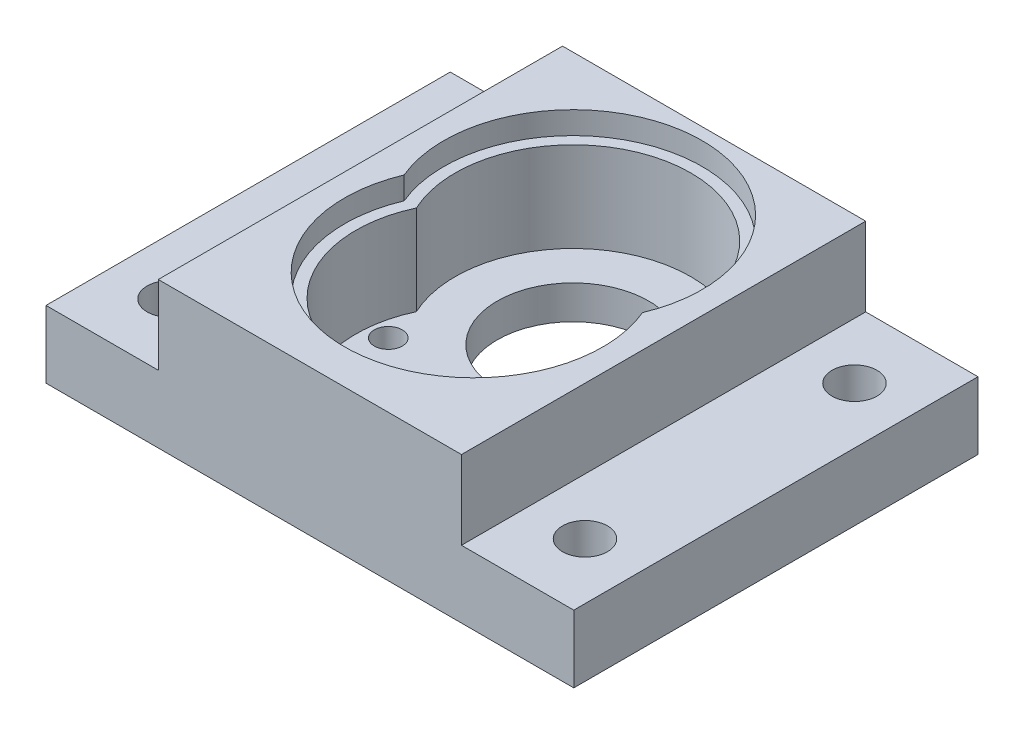
from build123d import *

# Parameters (mm, degrees)
SKETCH_1_W          = 27
SKETCH_1_H          = 36
SKETCH_1_R          = 6.75
SKETCH_1_R_2        = 1.5
SKETCH_1_R_3        = 1.25
EXTRUDE_1_DEPTH     = 3
SKETCH_4_W          = 10
SKETCH_4_H          = 6
EXTRUDE_3_DEPTH     = 36
SKETCH_6_R          = 3
CUT_EXTRUDE_3_DEPTH = 1
EXTRUDE_4_OUTLINE_W = 27
EXTRUDE_4_OUTLINE_H = 36
EXTRUDE_4_DEPTH     = 10
CUT_EXTRUDE_START   = 10
CUT_EXTRUDE_5_DEPTH = 2
SKETCH_13_R         = 2
CUT_EXTRUDE_6_DEPTH = 10


# Read off the part's stored shape, not the designer's step: 凸台-拉伸4
with BuildPart() as part:
    # 草图1 → 凸台-拉伸1 (new body)
    with BuildSketch(Plane(origin=(0, 0, 0), x_dir=(1, 0, 0), z_dir=(0, 1, 0))):
        with Locations((0, 2.267700118)):
            Rectangle(SKETCH_1_W, SKETCH_1_H)
        with Locations(Location((0, 7.7, 0), (0, 0, 270))):
            Circle(SKETCH_1_R, mode=Mode.SUBTRACT)
        with Locations(Location((0, -4.3, 0), (0, 0, 270))):
            Circle(SKETCH_1_R_2, mode=Mode.SUBTRACT)
        with Locations(Location((-8.75, 0, 0), (0, 0, 90))):
            Circle(SKETCH_1_R_3, mode=Mode.SUBTRACT)
        with Locations(Location((-2.7, -10.732299882, 0), (0, 0, 90))):
            Circle(SKETCH_1_R_2, mode=Mode.SUBTRACT)
        with Locations(Location((8.75, 0, 0), (0, 0, 270))):
            Circle(SKETCH_1_R_3, mode=Mode.SUBTRACT)
        with Locations(Location((2.7, -10.732299882, 0), (0, 0, 270))):
            Circle(SKETCH_1_R_2, mode=Mode.SUBTRACT)
    extrude(amount=EXTRUDE_1_DEPTH)

    # 草图4 → 凸台-拉伸3 (add)
    with BuildSketch(Plane(origin=(0, 0, -20.267700118), x_dir=(-1, 0, 0), z_dir=(0, 0, -1))):
        with Locations((-18.5, 3)):
            Rectangle(SKETCH_4_W, SKETCH_4_H)
        with Locations((18.5, 3)):
            Rectangle(SKETCH_4_W, SKETCH_4_H)
    extrude(amount=-EXTRUDE_3_DEPTH)

    # 草图6 → 切除-拉伸3 (cut)
    with BuildSketch(Plane.XZ):
        with Locations(Location((-8.75, 0, 0), (0, 0, 270))):
            Circle(SKETCH_6_R)
        with Locations(Location((8.75, 0, 0), (0, 0, 270))):
            Circle(SKETCH_6_R)
    extrude(amount=-CUT_EXTRUDE_3_DEPTH, mode=Mode.SUBTRACT)

    # 凸台-拉伸4 outline → 凸台-拉伸4 (add)
    with BuildSketch(Plane(origin=(0, 3, 0), x_dir=(1, 0, 0), z_dir=(0, 1, 0))):
        with Locations((0, 2.267700118)):
            Rectangle(EXTRUDE_4_OUTLINE_W, EXTRUDE_4_OUTLINE_H)
        with BuildLine():
            ThreePointArc((-1.435964828, -11.539898225), (-3.106363606, -12.176207296), (-4.199704154, -10.762089989))
            ThreePointArc((-4.199704154, -10.762089989), (-9.817841219, -4.861453177), (-9.52470472, 3.280724041))
            ThreePointArc((-9.52470472, 3.280724041), (0, 18.2), (9.52470472, 3.280724041))
            ThreePointArc((9.52470472, 3.280724041), (9.817841219, -4.861453177), (4.199704154, -10.762089989))
            ThreePointArc((4.199704154, -10.762089989), (3.106363606, -12.176207296), (1.435964828, -11.539898225))
            ThreePointArc((1.435964828, -11.539898225), (0, -11.638551918), (-1.435964828, -11.539898225))
        make_face(mode=Mode.SUBTRACT)
    extrude(amount=EXTRUDE_4_DEPTH)

    # 草图9 → 切除-拉伸5 (cut)
    with BuildSketch(Plane(origin=(0, 3, 0), x_dir=(1, 0, 0), z_dir=(0, 1, 0)).offset(CUT_EXTRUDE_START)):
        with BuildLine():
            ThreePointArc((10.616967552, 3.280724041), (0, 19.2), (-10.616967552, 3.280724041))
            ThreePointArc((-10.616967552, 3.280724041), (0, -12.638551918), (10.616967552, 3.280724041))
        make_face()
    extrude(amount=-CUT_EXTRUDE_5_DEPTH, mode=Mode.SUBTRACT)

    # 草图13 → 切除-拉伸6 (cut)
    with BuildSketch(Plane(origin=(0, 6, 0), x_dir=(1, 0, 0), z_dir=(0, 1, 0))):
        with Locations(Location((-18.5, 14.267700118, 0), (0, 0, 180))):
            Circle(SKETCH_13_R)
        with Locations(Location((-18.5, -9.732299882, 0), (0, 0, 180))):
            Circle(SKETCH_13_R)
        with Locations(Location((18.5, -9.732299882, 0), (0, 0, 90))):
            Circle(SKETCH_13_R)
        with Locations(Location((18.5, 14.267700118, 0), (0, 0, 90))):
            Circle(SKETCH_13_R)
    extrude(amount=-CUT_EXTRUDE_6_DEPTH, mode=Mode.SUBTRACT)


solid = part.part
